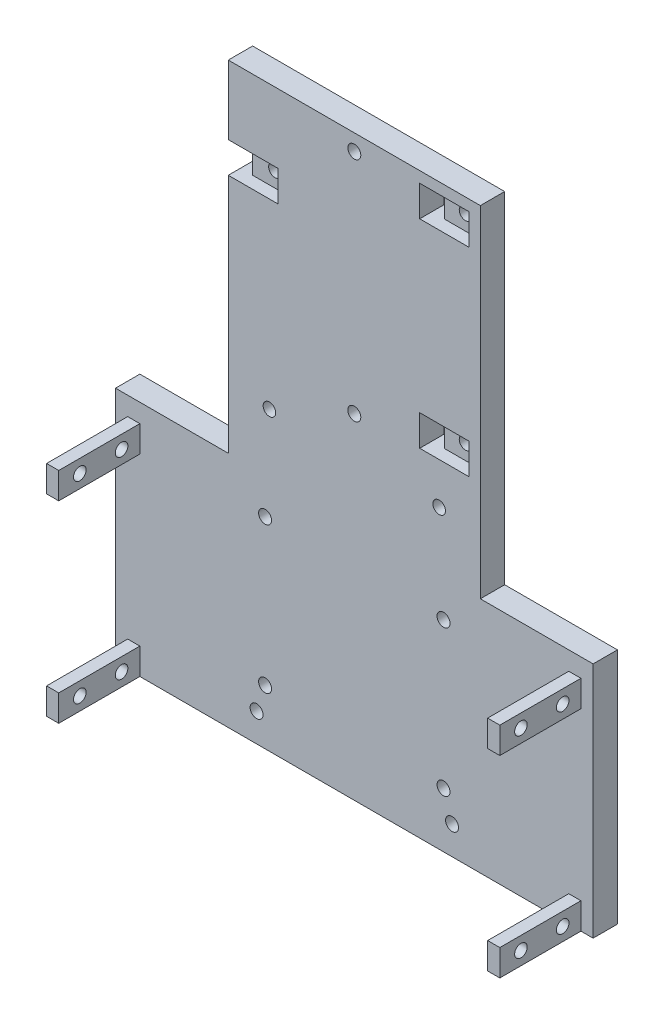
from build123d import *

# Parameters (mm, degrees)
SKETCH1_W               = 132
SKETCH1_H               = 165.15
BOSS_EXTRUDE1_DEPTH     = 6
SKETCH3_W               = 32
SKETCH3_H               = 54
SKETCH3_W_2             = 26
SKETCH3_H_2             = 48
BOSS_EXTRUDE2_DEPTH     = 17.5
SKETCH4_W               = 32
SKETCH4_H               = 54
BOSS_EXTRUDE3_DEPTH     = 3
SKETCH5_W               = 25
SKETCH5_H               = 17
CUT_EXTRUDE1_DEPTH      = 3
SKETCH6_W               = 12
SKETCH6_H               = 54
BOSS_EXTRUDE4_DEPTH     = 3
SKETCH7_R               = 1.6
CUT_EXTRUDE2_DEPTH      = 108.148871319
SKETCH8_W               = 3
SKETCH8_H               = 6.5
BOSS_EXTRUDE5_DEPTH     = 20
SKETCH9_R               = 1.55
CUT_EXTRUDE3_DEPTH      = 6
CUT_EXTRUDE4_DEPTH      = 3
CUT_EXTRUDE4_DEPTH_BACK = 109.981102146
SKETCH10_R              = 1.6
SKETCH10_R_2            = 1.55
SKETCH11_W              = 2.5
SKETCH11_H              = 7
BOSS_EXTRUDE6_DEPTH     = 19.36
SKETCH12_R              = 1.6
CUT_EXTRUDE5_DEPTH      = 19.36
SKETCH13_W              = 3
SKETCH13_H              = 7
BOSS_EXTRUDE7_DEPTH     = 15
SKETCH14_R              = 2
CUT_EXTRUDE6_DEPTH      = 15
CUT_EXTRUDE7_START      = -6
CUT_EXTRUDE7_DEPTH      = 6
SKETCH16_R              = 1.6
CUT_EXTRUDE8_DEPTH      = 15
SKETCH17_W              = 61.848581877
SKETCH17_H              = 62.95797348
CUT_EXTRUDE9_DEPTH      = 52
SKETCH19_R              = 1.55
CUT_EXTRUDE10_DEPTH     = 52
CUT_EXTRUDE11_DEPTH     = 3
SKETCH21_W              = 2.5
SKETCH21_H              = 7
CUT_EXTRUDE12_DEPTH     = 49
SKETCH22_W              = 3
SKETCH22_H              = 7
CUT_EXTRUDE13_DEPTH     = 49
SKETCH22_3_W            = 3
SKETCH22_3_H            = 7
SKETCH22_3_W_2          = 9
CUT_EXTRUDE14_DEPTH     = 3
SKETCH23_R              = 1.55
CUT_EXTRUDE15_DEPTH     = 3
SKETCH26_W              = 3
SKETCH26_H              = 7.6
SKETCH26_W_2            = 3.1
CUT_EXTRUDE17_DEPTH     = 10
SKETCH27_W              = 9.3
SKETCH27_H              = 7.6
SKETCH27_W_2            = 9
CUT_EXTRUDE18_DEPTH     = 3


# Read off the part's stored shape, not the designer's step: Cut-Extrude7
with BuildPart() as part:
    # Sketch1 → Boss-Extrude1 (new body)
    with BuildSketch(Plane.XY):
        Rectangle(SKETCH1_W, SKETCH1_H)
    extrude(amount=BOSS_EXTRUDE1_DEPTH)

    # Sketch3 → Boss-Extrude2 (add)
    with BuildSketch(Plane.XY.offset(6)):
        with Locations((0, -55.575)):
            Rectangle(SKETCH3_W, SKETCH3_H)
        with Locations((0, -55.575)):
            Rectangle(SKETCH3_W_2, SKETCH3_H_2, mode=Mode.SUBTRACT)
    extrude(amount=BOSS_EXTRUDE2_DEPTH)

    # Sketch4 → Boss-Extrude3 (add)
    with BuildSketch(Plane.XY.offset(23.5)):
        with Locations((0, -55.575)):
            Rectangle(SKETCH4_W, SKETCH4_H)
    extrude(amount=BOSS_EXTRUDE3_DEPTH)

    # Sketch5 → Cut-Extrude1 (cut)
    with BuildSketch(Plane.XZ.offset(82.575)):
        with Locations((0, 14.5)):
            Rectangle(SKETCH5_W, SKETCH5_H)
    extrude(amount=-CUT_EXTRUDE1_DEPTH, mode=Mode.SUBTRACT)

    # Sketch6 → Boss-Extrude4 (add)
    with BuildSketch(Plane.XY.offset(6)):
        with Locations((-22, -55.575)):
            Rectangle(SKETCH6_W, SKETCH6_H)
        with Locations((22, -55.575)):
            Rectangle(SKETCH6_W, SKETCH6_H)
    extrude(amount=BOSS_EXTRUDE4_DEPTH)

    # Sketch7 → Cut-Extrude2 (cut, through all)
    with BuildSketch(Plane.XY.offset(9)):
        with Locations((-22, -69.005)):
            Circle(SKETCH7_R)
        with Locations((-22, -33.005)):
            Circle(SKETCH7_R)
        with Locations(Location((22, -69.005, 0), (0, 0, 180))):
            Circle(SKETCH7_R)
        with Locations(Location((22, -33.005, 0), (0, 0, 180))):
            Circle(SKETCH7_R)
    extrude(amount=-CUT_EXTRUDE2_DEPTH, mode=Mode.SUBTRACT)

    # Sketch8 → Boss-Extrude5 (add)
    with BuildSketch(Plane.XY.offset(6)):
        with Locations((-54.38, -79.325)):
            Rectangle(SKETCH8_W, SKETCH8_H)
        with Locations((-54.38, -31.825)):
            Rectangle(SKETCH8_W, SKETCH8_H)
    boss_extrude5 = extrude(amount=BOSS_EXTRUDE5_DEPTH)

    # Sketch9 → Cut-Extrude3 (cut)
    with BuildSketch(Plane.ZY.offset(55.88)):
        with Locations((10.5, -79.325)):
            Circle(SKETCH9_R)
        with Locations((20.8, -79.325)):
            Circle(SKETCH9_R)
        with Locations((10.5, -31.825)):
            Circle(SKETCH9_R)
        with Locations((20.8, -31.825)):
            Circle(SKETCH9_R)
    cut_extrude3 = extrude(amount=-CUT_EXTRUDE3_DEPTH, mode=Mode.SUBTRACT)

    # Mirror1: Boss-Extrude5, Cut-Extrude3 across plane
    add(boss_extrude5.mirror(Plane(origin=(0, 0, 0), x_dir=(0, 0, 1), z_dir=(1, 0, 0))))
    add(cut_extrude3.mirror(Plane(origin=(0, 0, 0), x_dir=(0, 0, 1), z_dir=(1, 0, 0))), mode=Mode.SUBTRACT)

    # Sketch10 → Cut-Extrude4 (cut, two sides: drawn at the far end of the back side and taken through both)
    with BuildSketch(Plane(origin=(0, 0, 0), x_dir=(-1, 0, 0), z_dir=(0, 0, -1)).offset(-CUT_EXTRUDE4_DEPTH_BACK)):
        with Locations(Location((-24.1, -75.572749788, 0), (0, 0, 180))):
            Circle(SKETCH10_R)
        with Locations(Location((-20.925, -9.532749788, 0), (0, 0, 180))):
            Circle(SKETCH10_R_2)
        with Locations(Location((20.925, -9.532749788, 0), (0, 0, 180))):
            Circle(SKETCH10_R_2)
        with Locations(Location((24.1, -75.572749788, 0), (0, 0, 180))):
            Circle(SKETCH10_R)
    extrude(amount=CUT_EXTRUDE4_DEPTH + CUT_EXTRUDE4_DEPTH_BACK, mode=Mode.SUBTRACT)

    # Sketch11 → Boss-Extrude6 (add)
    with BuildSketch(Plane(origin=(0, 0, 0), x_dir=(-1, 0, 0), z_dir=(0, 0, -1))):
        with Locations((-17.675, 4.467250212)):
            Rectangle(SKETCH11_W, SKETCH11_H)
        with Locations((-17.675, 53.467250212)):
            Rectangle(SKETCH11_W, SKETCH11_H)
    extrude(amount=BOSS_EXTRUDE6_DEPTH)

    # Sketch12 → Cut-Extrude5 (cut)
    with BuildSketch(Plane(origin=(18.925, 0, 0), x_dir=(0, 0, -1), z_dir=(1, 0, 0))):
        with Locations(Location((4.5, 53.467250212, 0), (0, 0, 90))):
            Circle(SKETCH12_R)
        with Locations(Location((14.5, 53.467250212, 0), (0, 0, 90))):
            Circle(SKETCH12_R)
        with Locations(Location((4.5, 4.467250212, 0), (0, 0, 90))):
            Circle(SKETCH12_R)
        with Locations(Location((14.5, 4.467250212, 0), (0, 0, 90))):
            Circle(SKETCH12_R)
    extrude(amount=-CUT_EXTRUDE5_DEPTH, mode=Mode.SUBTRACT)

    # Sketch13 → Boss-Extrude7 (add)
    with BuildSketch(Plane(origin=(0, 0, 0), x_dir=(-1, 0, 0), z_dir=(0, 0, -1))):
        with Locations((29.575, 39.167250212)):
            Rectangle(SKETCH13_W, SKETCH13_H)
    extrude(amount=BOSS_EXTRUDE7_DEPTH)

    # Sketch14 → Cut-Extrude6 (cut)
    with BuildSketch(Plane.ZY.offset(31.075)):
        with Locations((-9.9, 39.167250212)):
            Circle(SKETCH14_R)
    extrude(amount=-CUT_EXTRUDE6_DEPTH, mode=Mode.SUBTRACT)

    # Cut-Extrude7 outline → Cut-Extrude7 (cut)
    with BuildSketch(Plane(origin=(0, 0, 0), x_dir=(-1, 0, 0), z_dir=(0, 0, -1)).offset(CUT_EXTRUDE7_START)):
        Polygon((-31.075, 59.967250212), (31.075, 59.967250212), (31.075, -24), (58.88, -24), (58.88, -82.575), (66, -82.575), (66, 82.575), (-66, 82.575), (-66, -82.575), (-58.88, -82.575), (-58.88, -24), (-31.075, -24), align=None)
    extrude(amount=CUT_EXTRUDE7_DEPTH, mode=Mode.SUBTRACT)

    # Sketch16 → Cut-Extrude8 (cut)
    with BuildSketch(Plane(origin=(0, 0, 0), x_dir=(-1, 0, 0), z_dir=(0, 0, -1))):
        Circle(SKETCH16_R)
        with Locations((0, 55.967250212)):
            Circle(SKETCH16_R)
    extrude(amount=-CUT_EXTRUDE8_DEPTH, mode=Mode.SUBTRACT)

    # Sketch17 → Cut-Extrude9 (cut)
    with BuildSketch(Plane.XY.offset(6)):
        with Locations((1.152470824, -55.437355719)):
            Rectangle(SKETCH17_W, SKETCH17_H)
    extrude(amount=CUT_EXTRUDE9_DEPTH, mode=Mode.SUBTRACT)

    # Sketch19 → Cut-Extrude10 (cut)
    with BuildSketch(Plane.XY.offset(6)):
        with Locations((24.425, 4.467250212)):
            Circle(SKETCH19_R)
    cut_extrude10 = extrude(amount=-CUT_EXTRUDE10_DEPTH, mode=Mode.SUBTRACT)

    # Sketch19<3> → Cut-Extrude11 (cut)
    with BuildSketch(Plane.XY.offset(6)):
        Polygon((18.925, 0.967250212), (16.425, 0.967250212), (16.425, 7.967250212), (18.925, 7.967250212), (27.925, 7.967250212), (27.925, 0.967250212), align=None)
    cut_extrude11 = extrude(amount=-CUT_EXTRUDE11_DEPTH, mode=Mode.SUBTRACT)

    # Sketch21 → Cut-Extrude12 (cut)
    with BuildSketch(Plane(origin=(0, 0, -19.36), x_dir=(-1, 0, 0), z_dir=(0, 0, -1))):
        with Locations((-17.675, 4.467250212)):
            Rectangle(SKETCH21_W, SKETCH21_H)
    cut_extrude12 = extrude(amount=-CUT_EXTRUDE12_DEPTH, mode=Mode.SUBTRACT)

    # Mirror2: Cut-Extrude10, Cut-Extrude11, Cut-Extrude12 across plane
    add(cut_extrude10.mirror(Plane(origin=(0, 28.967250212, 0), x_dir=(0, 0, 1), z_dir=(0, -1, 0))), mode=Mode.SUBTRACT)
    add(cut_extrude11.mirror(Plane(origin=(0, 28.967250212, 0), x_dir=(0, 0, 1), z_dir=(0, -1, 0))), mode=Mode.SUBTRACT)
    add(cut_extrude12.mirror(Plane(origin=(0, 28.967250212, 0), x_dir=(0, 0, 1), z_dir=(0, -1, 0))), mode=Mode.SUBTRACT)

    # Sketch22 → Cut-Extrude13 (cut)
    with BuildSketch(Plane.XY.offset(6)):
        with Locations((-29.575, 39.167250212)):
            Rectangle(SKETCH22_W, SKETCH22_H)
    extrude(amount=-CUT_EXTRUDE13_DEPTH, mode=Mode.SUBTRACT)

    # Sketch22<3> → Cut-Extrude14 (cut)
    with BuildSketch(Plane.XY.offset(6)):
        with Locations((-29.575, 39.167250212)):
            Rectangle(SKETCH22_3_W, SKETCH22_3_H)
        with Locations((-23.575, 39.167250212)):
            Rectangle(SKETCH22_3_W_2, SKETCH22_3_H)
    extrude(amount=-CUT_EXTRUDE14_DEPTH, mode=Mode.SUBTRACT)

    # Sketch23 → Cut-Extrude15 (cut)
    with BuildSketch(Plane.XY.offset(3)):
        with Locations((-22.575, 39.167250212)):
            Circle(SKETCH23_R)
    extrude(amount=-CUT_EXTRUDE15_DEPTH, mode=Mode.SUBTRACT)

    # Sketch26 → Cut-Extrude17 (cut)
    with BuildSketch(Plane(origin=(0, 0, 0), x_dir=(-1, 0, 0), z_dir=(0, 0, -1))):
        with Locations((29.575, 39.167250212)):
            Rectangle(SKETCH26_W, SKETCH26_H)
        with Locations((-17.675, 53.467250212)):
            Rectangle(SKETCH26_W_2, SKETCH26_H)
        with Locations((-17.675, 4.467250212)):
            Rectangle(SKETCH26_W_2, SKETCH26_H)
    extrude(amount=-CUT_EXTRUDE17_DEPTH, mode=Mode.SUBTRACT)

    # Sketch27 → Cut-Extrude18 (cut)
    with BuildSketch(Plane.XY.offset(6)):
        with Locations((-23.425, 39.167250212)):
            Rectangle(SKETCH27_W, SKETCH27_H)
        with Locations((23.725, 4.467250212)):
            Rectangle(SKETCH27_W_2, SKETCH27_H)
        with Locations((23.575, 53.467250212)):
            Rectangle(SKETCH27_W, SKETCH27_H)
    extrude(amount=-CUT_EXTRUDE18_DEPTH, mode=Mode.SUBTRACT)


solid = part.part
